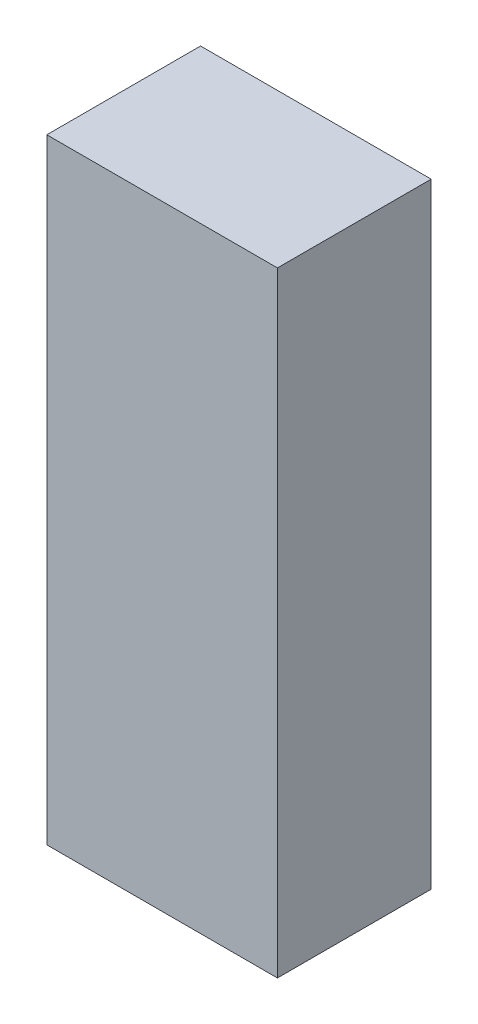
from build123d import *

# Parameters (mm, degrees)
SKETCH1_W           = 38.1
SKETCH1_H           = 25.4
BOSS_EXTRUDE1_DEPTH = 101.6


with BuildPart() as part:
    # Sketch1 → Boss-Extrude1 (new body)
    with BuildSketch(Plane(origin=(0, 0, 0), x_dir=(1, 0, 0), z_dir=(0, 1, 0))):
        with Locations((19.05, 12.7)):
            Rectangle(SKETCH1_W, SKETCH1_H)
    extrude(amount=BOSS_EXTRUDE1_DEPTH)


solid = part.part
